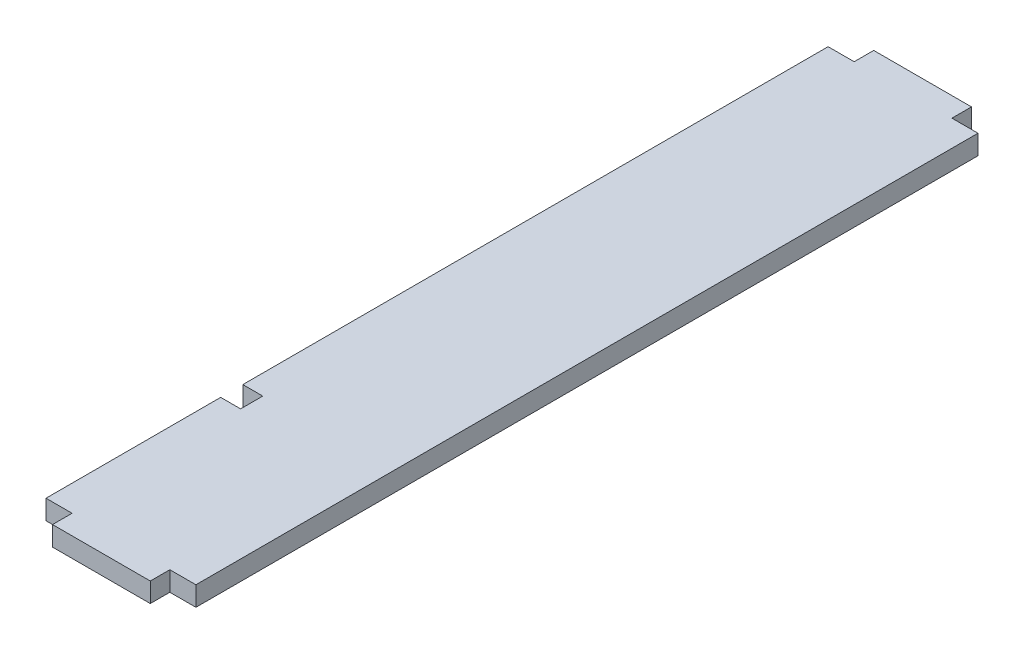
from build123d import *

# Parameters (mm, degrees)
BOSS_EXTRUDE1_DEPTH = 1.5


with BuildPart() as part:
    # Sketch1 → Boss-Extrude1 (new body)
    with BuildSketch(Plane(origin=(0, 0, 0), x_dir=(1, 0, 0), z_dir=(0, 1, 0))):
        Polygon((3.75, 30), (5.75, 30), (5.75, -30), (3.75, -30), (3.75, -31.5), (-3.75, -31.5), (-3.75, -30), (-5.75, -30), (-5.75, -16.6), (-4.22046249, -16.6), (-4.22046249, -14.9), (-5.75, -14.9), (-5.75, 30), (-3.75, 30), (-3.75, 31.5), (3.75, 31.5), align=None)
    extrude(amount=BOSS_EXTRUDE1_DEPTH)


solid = part.part
